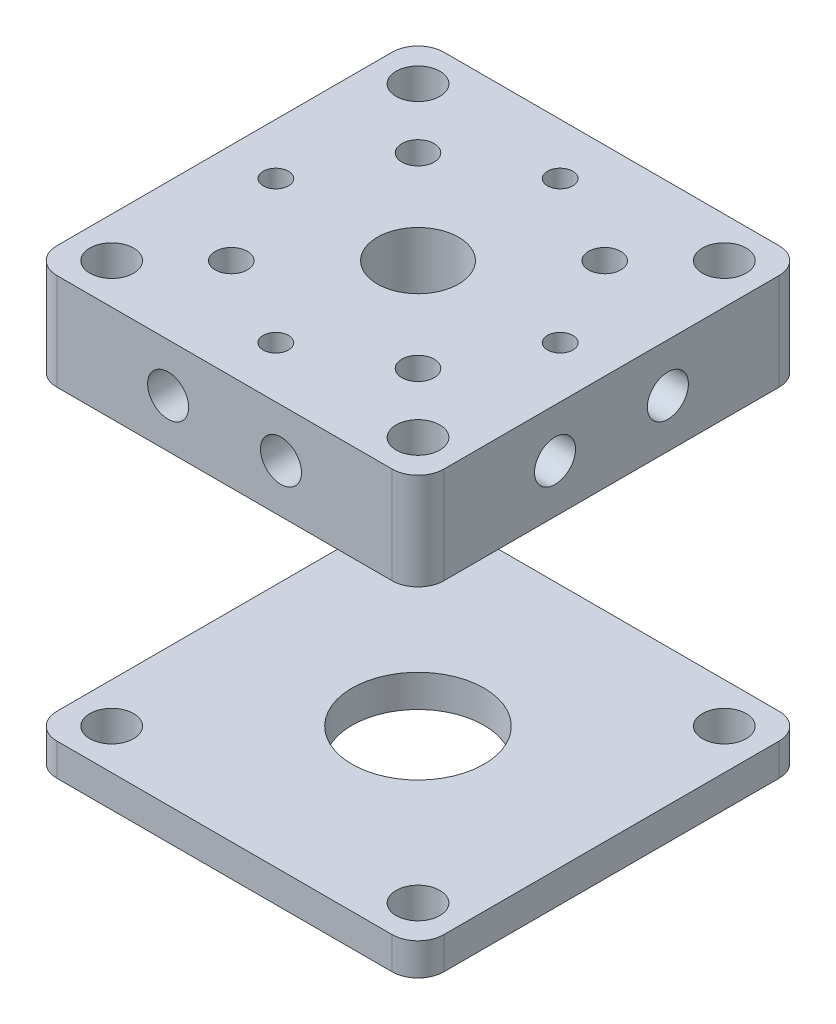
from build123d import *

# Parameters (mm, degrees)
SKETCH1_W           = 38.1
SKETCH1_H           = 38.1
SKETCH1_R           = 1.25
SKETCH1_R_2         = 1.5875
SKETCH1_R_3         = 4
BOSS_EXTRUDE1_DEPTH = 4.7625
SKETCH4_R           = 2.0193
CUT_EXTRUDE2_DEPTH  = 9.525
SKETCH7_R           = 2.15265
CUT_EXTRUDE3_DEPTH  = 29.575
CIRPATTERN1_COUNT   = 4
SKETCH6_W           = 38.1
SKETCH6_H           = 38.1
SKETCH6_R           = 6.5
SKETCH6_R_2         = 2.15265
BOSS_EXTRUDE2_DEPTH = 3.175
FILLET1_R           = 2.54
FILLET2_R           = 2.54


with BuildPart() as part:
    # Sketch1 → Boss-Extrude1 (new, symmetric)
    with BuildSketch(Plane(origin=(0, 0, 0), x_dir=(1, 0, 0), z_dir=(0, 1, 0))):
        Rectangle(SKETCH1_W, SKETCH1_H)
        with Locations((0, -14)):
            Circle(SKETCH1_R, mode=Mode.SUBTRACT)
        with Locations((-9.192388155, -9.192388155)):
            Circle(SKETCH1_R_2, mode=Mode.SUBTRACT)
        with Locations((9.192388155, -9.192388155)):
            Circle(SKETCH1_R_2, mode=Mode.SUBTRACT)
        with Locations((-14, 0)):
            Circle(SKETCH1_R, mode=Mode.SUBTRACT)
        Circle(SKETCH1_R_3, mode=Mode.SUBTRACT)
        with BuildLine():
            ThreePointArc((-8.954362092, 10.761942182), (-7.988639297, 10.227349477), (-7.604888155, 9.192388155))
            ThreePointArc((-7.604888155, 9.192388155), (-10.396137013, 8.157426834), (-8.954362092, 10.761942182))
        make_face(mode=Mode.SUBTRACT)
        with BuildLine():
            ThreePointArc((1.25, 14), (0.027908743, 12.750311598), (-1.248753763, 13.944196429))
            ThreePointArc((-1.248753763, 13.944196429), (-0.027908743, 15.249688402), (1.25, 14))
        make_face(mode=Mode.SUBTRACT)
        with Locations((9.192388155, 9.192388155)):
            Circle(SKETCH1_R_2, mode=Mode.SUBTRACT)
        with Locations((14, 0)):
            Circle(SKETCH1_R, mode=Mode.SUBTRACT)
    extrude(amount=BOSS_EXTRUDE1_DEPTH, both=True)

    # Sketch4 → Cut-Extrude2 (cut)
    with BuildSketch(Plane.XY.offset(19.05)):
        with Locations((-5.55625, 0)):
            Circle(SKETCH4_R)
        with Locations((5.55625, 0)):
            Circle(SKETCH4_R)
    cut_extrude2 = extrude(amount=-CUT_EXTRUDE2_DEPTH, mode=Mode.SUBTRACT)

    # Sketch7 → Cut-Extrude3 (cut, through all)
    with BuildSketch(Plane.XZ.offset(4.7625)):
        with Locations((-15.08125, 15.08125)):
            Circle(SKETCH7_R)
        with Locations((15.08125, 15.08125)):
            Circle(SKETCH7_R)
        with Locations((15.08125, -15.08125)):
            Circle(SKETCH7_R)
        with Locations((-15.08125, -15.08125)):
            Circle(SKETCH7_R)
    extrude(amount=-CUT_EXTRUDE3_DEPTH, mode=Mode.SUBTRACT)

    # CirPattern1: Cut-Extrude2 ×4 about axis
    cirpattern1_axis = Axis((0, 4.7625, 0), (0, -1, 0))
    for i in range(1, CIRPATTERN1_COUNT):
        add(cut_extrude2.rotate(cirpattern1_axis, i * 360 / CIRPATTERN1_COUNT), mode=Mode.SUBTRACT)

    # Fillet1
    fillet1_edges = [part.edges().sort_by_distance(p)[0] for p in [
        (-19.05, 0, 19.05),
        (-19.05, 0, -19.05),
        (19.05, 0, -19.05),
        (19.05, 0, 19.05),
    ]]
    fillet(fillet1_edges, radius=FILLET1_R)


with BuildPart() as body_2:
    # Sketch6 → Boss-Extrude2 (new body)
    with BuildSketch(Plane(origin=(0, -34.9377, 0), x_dir=(-1, 0, 0), z_dir=(0, -1, 0))):
        Rectangle(SKETCH6_W, SKETCH6_H)
        Circle(SKETCH6_R, mode=Mode.SUBTRACT)
        with Locations((-15.08125, 15.08125)):
            Circle(SKETCH6_R_2, mode=Mode.SUBTRACT)
        with Locations((15.08125, 15.08125)):
            Circle(SKETCH6_R_2, mode=Mode.SUBTRACT)
        with Locations((15.08125, -15.08125)):
            Circle(SKETCH6_R_2, mode=Mode.SUBTRACT)
        with Locations((-15.08125, -15.08125)):
            Circle(SKETCH6_R_2, mode=Mode.SUBTRACT)
    extrude(amount=BOSS_EXTRUDE2_DEPTH)

    # Fillet2
    fillet2_edges = [body_2.edges().sort_by_distance(p)[0] for p in [
        (-19.05, -36.5252, 19.05),
        (-19.05, -36.5252, -19.05),
        (19.05, -36.5252, -19.05),
        (19.05, -36.5252, 19.05),
    ]]
    fillet(fillet2_edges, radius=FILLET2_R)


solid = Compound([part.part, body_2.part])
